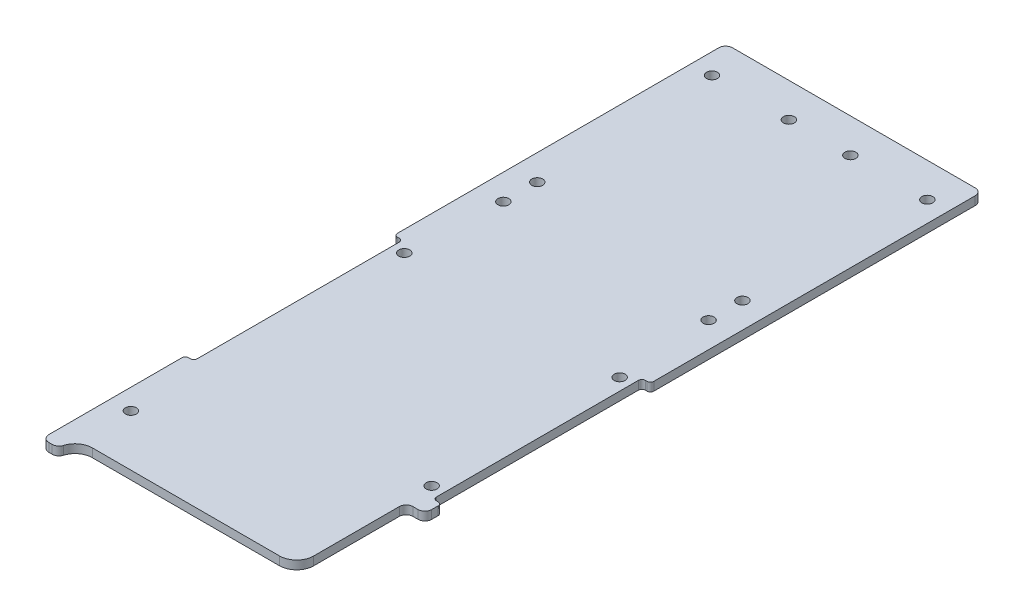
from build123d import *

# Parameters (mm, degrees)
SKETCH1_R               = 2.032
BOSS_EXTRUDE1_DEPTH     = 3.175
FILLET1_R               = 2.54
FILLET2_R               = 2.54
FILLET3_R               = 6.35
CUT_EXTRUDE1_DEPTH      = 136.673215063
FILLET4_R               = 6.35
FILLET5_R               = 2.54
SKETCH3_R               = 2.032
CUT_EXTRUDE2_DEPTH      = 136.673215063
CUT_EXTRUDE3_DEPTH      = 136.673215063
CUT_EXTRUDE3_DEPTH_BACK = 136.673215063
SKETCH4_W               = 3.17499648
SKETCH4_H               = 77.591915625
SKETCH4_W_2             = 3.17500352
SKETCH4_H_2             = 77.591904944
FILLET6_R               = 1.27


with BuildPart() as part:
    # Sketch1 → Boss-Extrude1 (new body)
    with BuildSketch(Plane(origin=(0, 0, 0), x_dir=(1, 0, 0), z_dir=(0, 1, 0))):
        Polygon((47.625, 127), (-47.625, 127), (-47.625, -127), (-41.275, -127), (-41.275, -120.65), (41.275, -120.65), (41.275, -127), (47.625, -127), align=None)
        with Locations((-39.999684148, -101.6)):
            Circle(SKETCH1_R, mode=Mode.SUBTRACT)
        with Locations((39.999684148, -69.85)):
            Circle(SKETCH1_R, mode=Mode.SUBTRACT)
        with Locations((-39.999684148, 0)):
            Circle(SKETCH1_R, mode=Mode.SUBTRACT)
        with Locations((-39.999684148, 114.3)):
            Circle(SKETCH1_R, mode=Mode.SUBTRACT)
        with Locations((-11.424684148, 114.3)):
            Circle(SKETCH1_R, mode=Mode.SUBTRACT)
        with Locations((39.999684148, 0)):
            Circle(SKETCH1_R, mode=Mode.SUBTRACT)
        with Locations((11.424684148, 114.3)):
            Circle(SKETCH1_R, mode=Mode.SUBTRACT)
        with Locations((39.999684148, 114.3)):
            Circle(SKETCH1_R, mode=Mode.SUBTRACT)
    extrude(amount=BOSS_EXTRUDE1_DEPTH)

    # Fillet1
    fillet1_edges = [part.edges().sort_by_distance(p)[0] for p in [
        (-47.625, 1.5875, -127),
        (47.625, 1.5875, -127),
        (47.625, 1.5875, 127),
        (-47.625, 1.5875, 127),
    ]]
    fillet(fillet1_edges, radius=FILLET1_R)

    # Fillet2
    fillet2_edges = [part.edges().sort_by_distance(p)[0] for p in [
        (41.275, 1.5875, 127),
        (-41.275, 1.5875, 127),
    ]]
    fillet(fillet2_edges, radius=FILLET2_R)

    # Fillet3
    fillet3_edges = [part.edges().sort_by_distance(p)[0] for p in [
        (41.275, 1.5875, 120.65),
        (-41.275, 1.5875, 120.65),
    ]]
    fillet(fillet3_edges, radius=FILLET3_R)

    # Sketch2 → Cut-Extrude1 (cut, through all)
    with BuildSketch(Plane.XZ):
        with BuildLine():
            Line((47.625, 131.883089137), (41.911864463, 131.883089137))
            Line((41.911864463, 131.883089137), (41.911864463, 126.142163824))
            ThreePointArc((41.911864463, 126.142163824), (41.594269331, 125.692864671), (41.380880287, 125.185714286))
            ThreePointArc((41.380880287, 125.185714286), (41.067924078, 124.353765798), (40.641864463, 123.573667677))
            Line((40.641864463, 123.573667677), (40.641864463, 79.981419179))
            Line((40.641864463, 79.981419179), (47.625, 79.981419179))
            Line((47.625, 79.981419179), (47.625, 131.883089137))
        make_face()
    extrude(amount=-CUT_EXTRUDE1_DEPTH, mode=Mode.SUBTRACT)

    # Fillet4
    fillet4_edges = [part.edges().sort_by_distance(p)[0] for p in [
        (40.641864463, 1.5875, 123.573667677),
    ]]
    fillet(fillet4_edges, radius=FILLET4_R)

    # Fillet5
    fillet5_edges = [part.edges().sort_by_distance(p)[0] for p in [
        (47.625, 1.5875, 79.981419179),
        (40.641864463, 1.5875, 79.981419179),
    ]]
    fillet(fillet5_edges, radius=FILLET5_R)

    # Sketch3 → Cut-Extrude2 (cut, through all)
    with BuildSketch(Plane.XZ):
        with Locations((-38.112058962, -34.913768806)):
            Circle(SKETCH3_R)
        with Locations((-38.112058962, -47.490173279)):
            Circle(SKETCH3_R)
        with Locations((38.112058962, -47.490173279)):
            Circle(SKETCH3_R)
        with Locations((38.112058962, -34.913768806)):
            Circle(SKETCH3_R)
    extrude(amount=-CUT_EXTRUDE2_DEPTH, mode=Mode.SUBTRACT)

    # Sketch4 → Cut-Extrude3 (cut, two sides: drawn at the far end of the back side and taken through both)
    with BuildSketch(Plane(origin=(0, 3.175, 0), x_dir=(1, 0, 0), z_dir=(0, 1, 0)).offset(-CUT_EXTRUDE3_DEPTH_BACK)):
        with Locations((-46.03750176, -34.985947149)):
            Rectangle(SKETCH4_W, SKETCH4_H)
        with Locations((46.03749824, -34.985941809)):
            Rectangle(SKETCH4_W_2, SKETCH4_H_2)
    extrude(amount=CUT_EXTRUDE3_DEPTH + CUT_EXTRUDE3_DEPTH_BACK, mode=Mode.SUBTRACT)

    # Fillet6
    fillet6_edges = [part.edges().sort_by_distance(p)[0] for p in [
        (-44.45000352, 1.5875, -3.810010663),
        (-44.45000352, 1.5875, 73.781904962),
        (44.44999648, 1.5875, -3.810010663),
        (44.44999648, 1.5875, 73.781894281),
        (47.625, 1.5875, 73.781894281),
        (47.625, 1.5875, -3.810010663),
        (-47.625, 1.5875, 73.781904962),
        (-47.625, 1.5875, -3.810010663),
    ]]
    fillet(fillet6_edges, radius=FILLET6_R)


solid = part.part
